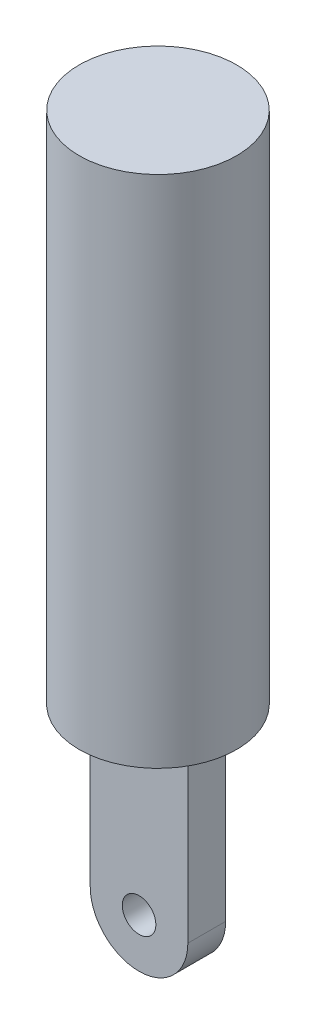
from build123d import *

# Parameters (mm, degrees)
SKETCH_1_R               = 9
EXTRUDE_1_DEPTH          = 52
SKETCH_2_R               = 7.8
EXTRUDE_2_DEPTH          = 12
EXTRUDE_3_DEPTH          = 1.8
EXTRUDE_3_DEPTH_BACK     = 1.8
SKETCH_3_R               = 2.6
EXTRUDE_4_DEPTH          = 1.8
EXTRUDE_4_DEPTH_BACK     = 1.8
SKETCH_4_R               = 1.6
CUT_EXTRUDE_1_DEPTH      = 26
CUT_EXTRUDE_1_DEPTH_BACK = 75
SKETCH_5_R               = 12.444758302
SKETCH_5_R_2             = 7.5
CUT_EXTRUDE_2_DEPTH      = 75
CUT_EXTRUDE_2_DEPTH_BACK = 15
SKETCH_6_R               = 11.570191829


with BuildPart() as part:
    # 草图1 → 凸台-拉伸1 (new body)
    with BuildSketch(Plane(origin=(0, 0, 0), x_dir=(1, 0, 0), z_dir=(0, 1, 0))):
        Circle(SKETCH_1_R)
    extrude(amount=EXTRUDE_1_DEPTH)

    # 草图2 → 凸台-拉伸2 (add)
    with BuildSketch(Plane(origin=(0, 52, 0), x_dir=(1, 0, 0), z_dir=(0, 1, 0))):
        Circle(SKETCH_2_R)
    extrude(amount=EXTRUDE_2_DEPTH)

    # 草图3 → 凸台-拉伸3 (add, two sides: drawn at the far end of the back side and taken through both)
    with BuildSketch(Plane.XY.offset(-EXTRUDE_3_DEPTH_BACK)):
        with BuildLine():
            Line((-4.255, 68.5), (-4.255, 59.5))
            Line((-4.255, 59.5), (4.255, 59.5))
            Line((4.255, 59.5), (4.255, 68.5))
            ThreePointArc((4.255, 68.5), (0, 72.755), (-4.255, 68.5))
        make_face()
        with Locations((0, 68.5)):
            Circle(SKETCH_3_R, mode=Mode.SUBTRACT)
    extrude(amount=EXTRUDE_3_DEPTH + EXTRUDE_3_DEPTH_BACK)

    # 草图4 → 凸台-拉伸4 (add, two sides: drawn at the far end of the back side and taken through both)
    with BuildSketch(Plane.XY.offset(-EXTRUDE_4_DEPTH_BACK)):
        with BuildLine():
            Line((-4.65, -16.5), (-4.65, -8.5))
            Line((-4.65, -8.5), (-4.65, 0))
            Line((-4.65, 0), (4.65, 0))
            Line((4.65, 0), (4.65, -8.5))
            Line((4.65, -8.5), (4.65, -16.5))
            ThreePointArc((4.65, -16.5), (0, -21.15), (-4.65, -16.5))
        make_face()
        with Locations((0, -16.5)):
            Circle(SKETCH_4_R, mode=Mode.SUBTRACT)
    extrude(amount=EXTRUDE_4_DEPTH + EXTRUDE_4_DEPTH_BACK)

    # 草图5 → 切除-拉伸1 (cut, two sides: drawn at the far end of the back side and taken through both)
    with BuildSketch(Plane.XZ.offset(-CUT_EXTRUDE_1_DEPTH_BACK)):
        Circle(SKETCH_5_R)
        Circle(SKETCH_5_R_2, mode=Mode.SUBTRACT)
    extrude(amount=CUT_EXTRUDE_1_DEPTH + CUT_EXTRUDE_1_DEPTH_BACK, mode=Mode.SUBTRACT)

    # 草图6 → 切除-拉伸2 (cut, two sides: drawn at the far end of the back side and taken through both)
    with BuildSketch(Plane(origin=(0, 64, 0), x_dir=(1, 0, 0), z_dir=(0, 1, 0)).offset(-CUT_EXTRUDE_2_DEPTH_BACK)):
        Circle(SKETCH_6_R)
    extrude(amount=CUT_EXTRUDE_2_DEPTH + CUT_EXTRUDE_2_DEPTH_BACK, mode=Mode.SUBTRACT)


solid = part.part
